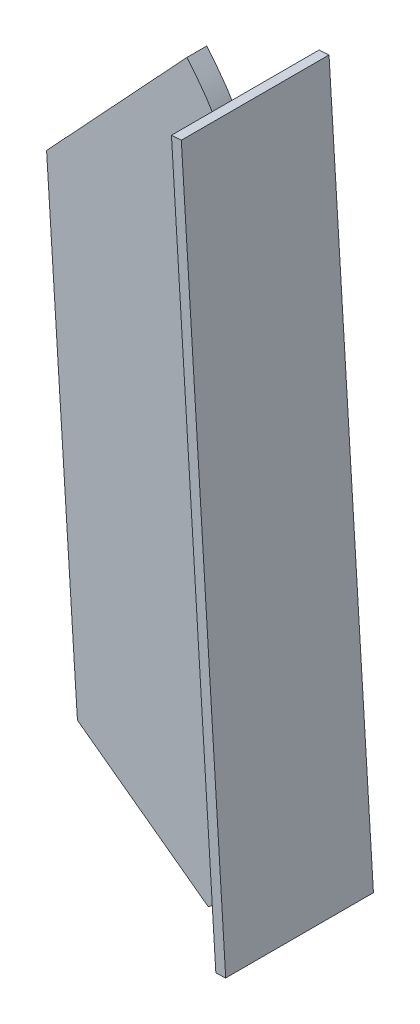
from build123d import *

# Parameters (mm, degrees)
EXTRUDE_1_DEPTH      = 1.2
CUT_EXTRUDE_START    = -1.2
CUT_EXTRUDE_1_DEPTH  = 1.2
EXTRUDE_2_DEPTH      = 0.3
EXTRUDE_2_DEPTH_BACK = 1.2
SKETCH_3_R           = 0.3
SKETCH_4_W           = 8.968131771
SKETCH_4_H           = 42.786888223
EXTRUDE_3_DEPTH      = 0.6


# Read off the part's stored shape, not the designer's step: Вырез-Вытянуть-Тонкостенный1
with BuildPart() as part:
    # Эскиз1 → Бобышка-Вытянуть1 (new body)
    with BuildSketch(Plane.XY):
        with BuildLine():
            Line((-5.411197125, -16.421197495), (2.932953168, -22.548932866))
            Line((2.932953168, -22.548932866), (7.313221262, -18.965077153))
            Line((7.313221262, -18.965077153), (5.214911567, 14.277588478))
            add(Edge.make_bspline(
                [(5.214911567, 14.277588478), (5.138438722, 15.014978004), (4.987374421, 16.471615759), (4.285048461, 18.555840063), (3.313335464, 20.541616369), (2.370787647, 21.6834935), (1.892587883, 22.262822595)],
                knots=[0, 0, 0, 0, 0.251767614, 0.497341227, 0.74497707, 1, 1, 1, 1], degree=3))
            Line((1.892587883, 22.262822595), (1.612438242, 22.548932866))
            Line((1.612438242, 22.548932866), (-7.313221262, 12.961413017))
            Line((-7.313221262, 12.961413017), (-5.451496049, -15.895327784))
            Line((-5.451496049, -15.895327784), (-5.411197125, -16.421197495))
        make_face()
    extrude(amount=EXTRUDE_1_DEPTH)

    # Вырез-Вытянуть-Тонкостенный1 outline → Вырез-Вытянуть-Тонкостенный1 (cut)
    with BuildSketch(Plane.XY.offset(1.2).offset(CUT_EXTRUDE_START)):
        with BuildLine():
            Line((7.313221262, -18.965077153), (5.214911567, 14.277588478))
            add(Edge.make_bspline(
                [(5.214911567, 14.277588478), (5.138438722, 15.014978004), (4.987374421, 16.471615759), (4.285048461, 18.555840063), (3.313335464, 20.541616369), (2.370787647, 21.6834935), (1.892587883, 22.262822595)],
                knots=[0, 0, 0, 0, 0.251767614, 0.497341227, 0.74497707, 1, 1, 1, 1], degree=3))
            Line((1.892587883, 22.262822595), (1.612438242, 22.548932866))
            Line((1.612438242, 22.548932866), (-7.313221262, 12.961413017))
            Line((-7.313221262, 12.961413017), (-5.451496049, -15.895327784))
            Line((-5.451496049, -15.895327784), (-5.411197125, -16.421197495))
            Line((-5.411197125, -16.421197495), (2.932953168, -22.548932866))
            Line((2.932953168, -22.548932866), (7.313221262, -18.965077153))
        make_face()
        with BuildLine():
            add(Edge.make_bspline(
                [(4.816213875, 14.244344904), (4.742720796, 14.952991901), (4.670057139, 15.661759974), (4.444177706, 16.707849761), (4.349214266, 17.051042697), (4.131298148, 17.722896385), (4.008075561, 18.052719847), (3.607234384, 19.028852016), (3.299546795, 19.66229506), (2.721200979, 20.562478072), (2.509851785, 20.852004475), (2.072144291, 21.416226224), (1.845069272, 21.691997878), (1.617672174, 21.967521187)],
                knots=[0, 0, 0, 0, 0.25, 0.25, 0.375, 0.375, 0.5, 0.5, 0.75, 0.75, 0.875, 0.875, 1, 1, 1, 1], degree=3))
            Line((4.816213875, 14.244344904), (6.901087174, -18.785453392))
            Line((6.901087174, -18.785453392), (2.919717459, -22.042937704))
            Line((2.919717459, -22.042937704), (-5.026399994, -16.2075077))
            Line((-5.026399994, -16.2075077), (-5.052481173, -15.867168531))
            Line((-5.052481173, -15.867168531), (-6.902948488, 12.81507484))
            Line((-6.902948488, 12.81507484), (1.617672174, 21.967521187))
        make_face(mode=Mode.SUBTRACT)
    extrude(amount=CUT_EXTRUDE_1_DEPTH, mode=Mode.SUBTRACT)

    # Эскиз3 → Бобышка-Вытянуть2 (add, two sides: drawn at the far end of the back side and taken through both)
    with BuildSketch(Plane(origin=(5.692649923, 0.359325653, 0), x_dir=(0, 0, -1), z_dir=(0.9980138039949711, 0.06299561123989302, 0)).offset(-EXTRUDE_2_DEPTH_BACK)):
        with Locations(Location((-0.6, -18.882880004, 0), (0, 0, 90))):
            Circle(SKETCH_3_R)
        with Locations(Location((-0.6, -7.882880004, 0), (0, 0, 90))):
            Circle(SKETCH_3_R)
        with Locations(Location((-0.6, 3.117119996, 0), (0, 0, 90))):
            Circle(SKETCH_3_R)
        with Locations(Location((-0.6, 14.117119996, 0), (0, 0, 90))):
            Circle(SKETCH_3_R)
    extrude(amount=EXTRUDE_2_DEPTH + EXTRUDE_2_DEPTH_BACK)

    # Эскиз4 → Бобышка-Вытянуть3 (add)
    with BuildSketch(Plane(origin=(5.992054064, 0.378224336, 0), x_dir=(0, 0, -1), z_dir=(0.9980138039949711, 0.06299561123989304, 0))):
        with Locations((-0.702688531, -0.337065509)):
            Rectangle(SKETCH_4_W, SKETCH_4_H)
    extrude(amount=EXTRUDE_3_DEPTH)


solid = part.part
